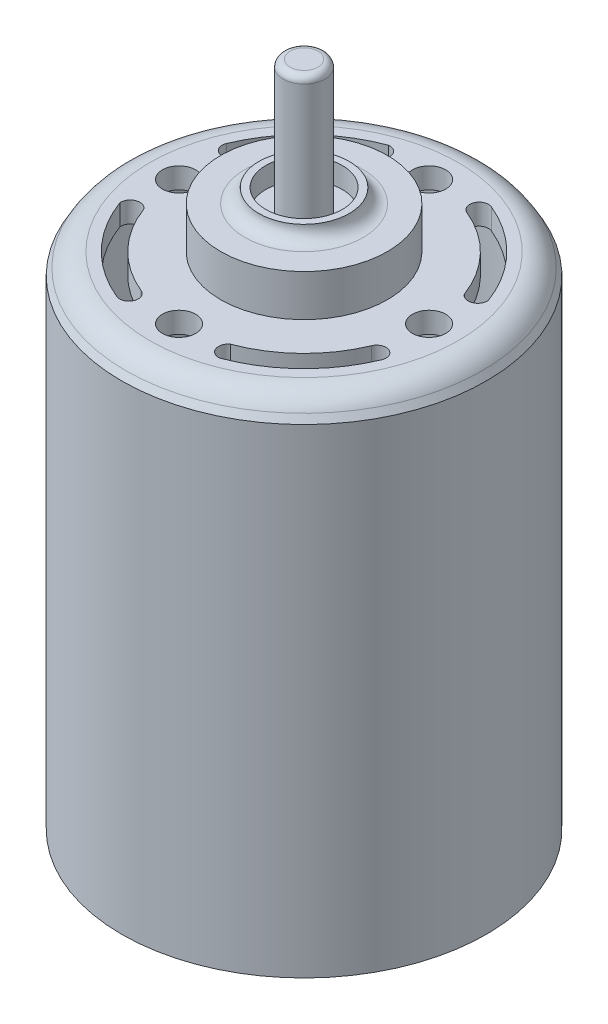
from build123d import *

# Parameters (mm, degrees)
SKETCH1_R            = 26.25
SKETCH1_R_2          = 25.5
BOSS_EXTRUDE1_DEPTH  = 69
SKETCH2_R            = 26.25
BOSS_EXTRUDE2_DEPTH  = 2
SKETCH3_R            = 24.522079948
BOSS_EXTRUDE3_DEPTH  = 1
FILLET1_R            = 4
SKETCH4_R            = 12
BOSS_EXTRUDE4_DEPTH  = 6
SKETCH5_R            = 6.5
BOSS_EXTRUDE5_DEPTH  = 2
SKETCH6_R            = 5.5
CUT_EXTRUDE1_DEPTH   = 3
FILLET3_R            = 2
SKETCH7_R            = 3
BOSS_EXTRUDE6_DEPTH  = 19
FILLET4_R            = 1
SKETCH9_R            = 2.4
CUT_EXTRUDE2_DEPTH   = 19
CUT_EXTRUDE3_DEPTH   = 19
SKETCH12_R           = 25.85
CUT_EXTRUDE4_DEPTH   = 1
BOSS_EXTRUDE7_DEPTH  = 1
FILLET6_R            = 0.1
BOSS_EXTRUDE8_START  = 6
SKETCH15_R           = 12
BOSS_EXTRUDE8_DEPTH  = 6
SKETCH16_R           = 6.5
CUT_EXTRUDE5_DEPTH   = 3
SKETCH17_R           = 8.341433134
SKETCH17_R_2         = 7.834680873
BOSS_EXTRUDE9_DEPTH  = 1
FILLET9_R            = 0.3
FILLET10_R           = 0.3
BOSS_EXTRUDE10_START = 5
SKETCH18_R           = 3
BOSS_EXTRUDE10_DEPTH = 5
FILLET11_R           = 2


# Read off the part's stored shape, not the designer's step: Boundary1
with BuildPart() as part:
    # Sketch1 → Boss-Extrude1 (new body)
    with BuildSketch(Plane(origin=(0, 0, 0), x_dir=(1, 0, 0), z_dir=(0, 1, 0))):
        with Locations(Location((0, 0, 0), (0, 0, 270))):
            Circle(SKETCH1_R)
        with Locations(Location((0, 0, 0), (0, 0, 270))):
            Circle(SKETCH1_R_2, mode=Mode.SUBTRACT)
    extrude(amount=BOSS_EXTRUDE1_DEPTH)

    # Sketch2 → Boss-Extrude2 (add)
    with BuildSketch(Plane(origin=(0, 0, 0), x_dir=(1, 0, 0), z_dir=(0, 1, 0))):
        with Locations(Location((0, 0, 0), (0, 0, 270))):
            Circle(SKETCH2_R)
    extrude(amount=BOSS_EXTRUDE2_DEPTH)



with BuildPart() as body_2:
    # Sketch3 → Boss-Extrude3 (new body)
    with BuildSketch(Plane(origin=(0, 71, 0), x_dir=(1, 0, 0), z_dir=(0, 1, 0))):
        with Locations(Location((0, 0, 0), (0, 0, 270))):
            Circle(SKETCH3_R)
    extrude(amount=BOSS_EXTRUDE3_DEPTH)


with BuildPart() as part_1:
    add(part.part)

    add(body_2.part)  # Boundary1 merges body 2
    # Boundary1 outline → Boundary1 (revolve)
    with BuildSketch(Plane.XY):
        Polygon((24.522079948, 72), (24.522079948, 71), (0, 71), (0, 69), (26.25, 69), align=None)
    revolve(axis=Axis((0, 0, 0), (0, 1, 0)))

    # Fillet1
    fillet1_edges = [part_1.edges().sort_by_distance(p)[0] for p in [
        (-24.522079948, 72, 0),
    ]]
    fillet(fillet1_edges, radius=FILLET1_R)

    # Sketch4 → Boss-Extrude4 (add)
    with BuildSketch(Plane(origin=(0, 72, 0), x_dir=(1, 0, 0), z_dir=(0, 1, 0))):
        with Locations(Location((0, 0, 0), (0, 0, 270))):
            Circle(SKETCH4_R)
    extrude(amount=BOSS_EXTRUDE4_DEPTH)

    # Sketch5 → Boss-Extrude5 (add)
    with BuildSketch(Plane(origin=(0, 78, 0), x_dir=(1, 0, 0), z_dir=(0, 1, 0))):
        with Locations(Location((0, 0, 0), (0, 0, 270))):
            Circle(SKETCH5_R)
    extrude(amount=BOSS_EXTRUDE5_DEPTH)

    # Sketch6 → Cut-Extrude1 (cut)
    with BuildSketch(Plane(origin=(0, 80, 0), x_dir=(1, 0, 0), z_dir=(0, 1, 0))):
        with Locations(Location((0, 0, 0), (0, 0, 270))):
            Circle(SKETCH6_R)
    extrude(amount=-CUT_EXTRUDE1_DEPTH, mode=Mode.SUBTRACT)

    # Fillet3
    fillet3_edges = [part_1.edges().sort_by_distance(p)[0] for p in [
        (0, 78, -6.5),
    ]]
    fillet(fillet3_edges, radius=FILLET3_R - 0.0001)  # a hair under: the kernel refuses the full size

    # Sketch7 → Boss-Extrude6 (add)
    with BuildSketch(Plane(origin=(0, 77, 0), x_dir=(1, 0, 0), z_dir=(0, 1, 0))):
        with Locations(Location((0, 0, 0), (0, 0, 270))):
            Circle(SKETCH7_R)
    extrude(amount=BOSS_EXTRUDE6_DEPTH)

    # Fillet4
    fillet4_edges = [part_1.edges().sort_by_distance(p)[0] for p in [
        (0, 96, -3),
    ]]
    fillet(fillet4_edges, radius=FILLET4_R)

    # Sketch9 → Cut-Extrude2 (cut)
    with BuildSketch(Plane(origin=(0, 72, 0), x_dir=(1, 0, 0), z_dir=(0, 1, 0))):
        with Locations(Location((0, 18, 0), (0, 0, 270))):
            Circle(SKETCH9_R)
        with Locations(Location((18, 0, 0), (0, 0, 270))):
            Circle(SKETCH9_R)
        with Locations(Location((0, -18, 0), (0, 0, 270))):
            Circle(SKETCH9_R)
        with Locations(Location((-18, 0, 0), (0, 0, 270))):
            Circle(SKETCH9_R)
    extrude(amount=-CUT_EXTRUDE2_DEPTH, mode=Mode.SUBTRACT)

    # Sketch10 → Cut-Extrude3 (cut)
    with BuildSketch(Plane(origin=(0, 72, 0), x_dir=(1, 0, 0), z_dir=(0, 1, 0))):
        with BuildLine():
            ThreePointArc((7.892200083, 19.072168819), (14.867271563, 14.317775032), (19.355735292, 7.168678881))
            ThreePointArc((19.355735292, 7.168678881), (18.449280331, 5.744014287), (16.833508421, 6.234535371))
            ThreePointArc((16.833508421, 6.234535371), (12.929931995, 12.452039818), (6.863775235, 16.586893216))
            ThreePointArc((6.863775235, 16.586893216), (6.135349858, 18.343743441), (7.892200083, 19.072168819))
        make_face()
        with BuildLine():
            ThreePointArc((6.234535371, -16.833508421), (12.452039818, -12.929931995), (16.586893216, -6.863775235))
            ThreePointArc((16.586893216, -6.863775235), (18.343743441, -6.135349858), (19.072168819, -7.892200083))
            ThreePointArc((19.072168819, -7.892200083), (14.317775032, -14.867271563), (7.168678881, -19.355735292))
            ThreePointArc((7.168678881, -19.355735292), (5.744014287, -18.449280331), (6.234535371, -16.833508421))
        make_face()
        with BuildLine():
            ThreePointArc((-16.833508421, -6.234535371), (-12.929931995, -12.452039818), (-6.863775235, -16.586893216))
            ThreePointArc((-6.863775235, -16.586893216), (-6.135349858, -18.343743441), (-7.892200083, -19.072168819))
            ThreePointArc((-7.892200083, -19.072168819), (-14.867271563, -14.317775032), (-19.355735292, -7.168678881))
            ThreePointArc((-19.355735292, -7.168678881), (-18.449280331, -5.744014287), (-16.833508421, -6.234535371))
        make_face()
        with BuildLine():
            ThreePointArc((-6.234535371, 16.833508421), (-12.452039818, 12.929931995), (-16.586893216, 6.863775235))
            ThreePointArc((-16.586893216, 6.863775235), (-18.343743441, 6.135349858), (-19.072168819, 7.892200083))
            ThreePointArc((-19.072168819, 7.892200083), (-14.317775032, 14.867271563), (-7.168678881, 19.355735292))
            ThreePointArc((-7.168678881, 19.355735292), (-5.744014287, 18.449280331), (-6.234535371, 16.833508421))
        make_face()
    extrude(amount=-CUT_EXTRUDE3_DEPTH, mode=Mode.SUBTRACT)

    # Sketch12 → Cut-Extrude4 (cut)
    with BuildSketch(Plane.XZ):
        with Locations(Location((0, 0, 0), (0, 0, 270))):
            Circle(SKETCH12_R)
    extrude(amount=-CUT_EXTRUDE4_DEPTH, mode=Mode.SUBTRACT)

    # Sketch13 → Boss-Extrude7 (add)
    with BuildSketch(Plane.XZ.offset(-1)):
        with BuildLine():
            Line((-11, -18), (11, -18))
            Line((11, -18), (11.049165655, -17.956034766))
            ThreePointArc((11.049165655, -17.956034766), (21.083245628, 0), (11.049165655, 17.956034766))
            Line((11.049165655, 17.956034766), (11, 18))
            Line((11, 18), (-11, 18))
            ThreePointArc((-11, 18), (-21.09502311, 0), (-11, -18))
        make_face()
    extrude(amount=BOSS_EXTRUDE7_DEPTH)

    # Fillet6
    fillet6_edges = [part_1.edges().sort_by_distance(p)[0] for p in [
        (0, 1, -18),
    ]]
    fillet(fillet6_edges, radius=FILLET6_R)

    # Sketch15 → Boss-Extrude8 (add)
    with BuildSketch(Plane.XZ.offset(BOSS_EXTRUDE8_START)):
        with Locations(Location((0, 0, 0), (0, 0, 90))):
            Circle(SKETCH15_R)
    extrude(amount=-BOSS_EXTRUDE8_DEPTH)

    # Sketch16 → Cut-Extrude5 (cut)
    with BuildSketch(Plane.XZ.offset(6)):
        with Locations(Location((0, 0, 0), (0, 0, 270))):
            Circle(SKETCH16_R)
    extrude(amount=-CUT_EXTRUDE5_DEPTH, mode=Mode.SUBTRACT)

    # Sketch17 → Boss-Extrude9 (add)
    with BuildSketch(Plane.XZ.offset(6)):
        with Locations(Location((0, 0, 0), (0, 0, 270))):
            Circle(SKETCH17_R)
        with Locations(Location((0, 0, 0), (0, 0, 270))):
            Circle(SKETCH17_R_2, mode=Mode.SUBTRACT)
    extrude(amount=BOSS_EXTRUDE9_DEPTH)

    # Fillet9
    fillet9_edges = [part_1.edges().sort_by_distance(p)[0] for p in [
        (0, -6, 8.341433134),
    ]]
    fillet(fillet9_edges, radius=FILLET9_R)

    # Fillet10
    fillet10_edges = [part_1.edges().sort_by_distance(p)[0] for p in [
        (0, -6, 7.834680873),
    ]]
    fillet(fillet10_edges, radius=FILLET10_R)

    # Sketch18 → Boss-Extrude10 (add)
    with BuildSketch(Plane.XZ.offset(3).offset(BOSS_EXTRUDE10_START)):
        with Locations(Location((0, 0, 0), (0, 0, 90))):
            Circle(SKETCH18_R)
    extrude(amount=-BOSS_EXTRUDE10_DEPTH)

    # Fillet11
    fillet11_edges = [part_1.edges().sort_by_distance(p)[0] for p in [
        (0, -8, -3),
    ]]
    fillet(fillet11_edges, radius=FILLET11_R)


solid = part_1.part
